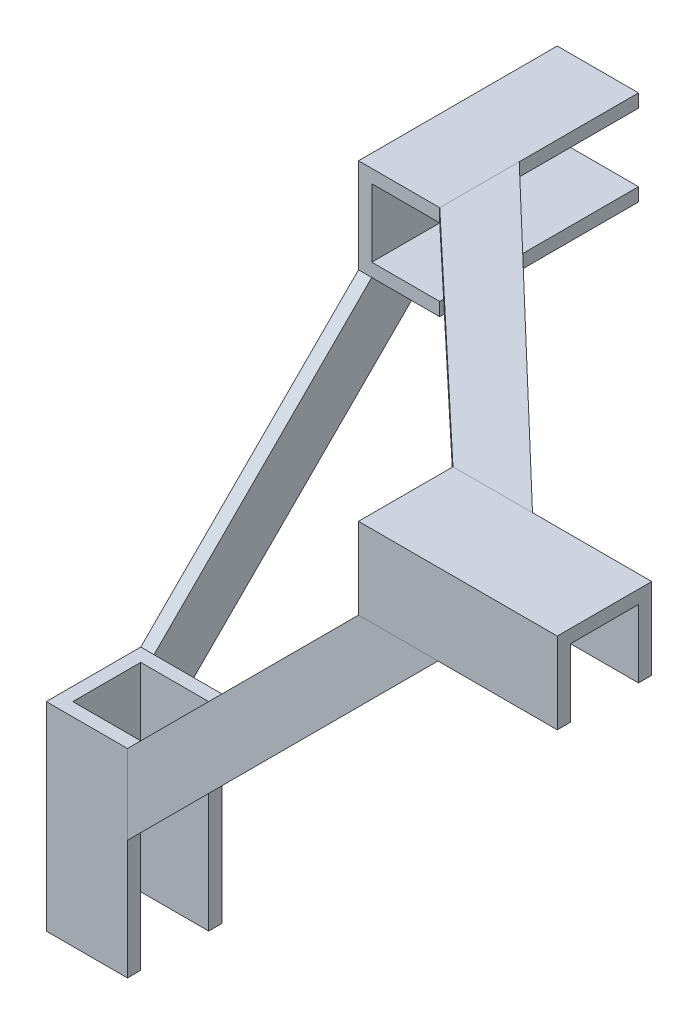
from build123d import *

# Parameters (mm, degrees)
C_START                                 = -12.825
C_CHANNEL_IGVC_5MM_CORNER_3_OUTLINE_W   = 162.175
C_CHANNEL_IGVC_5MM_CORNER_3_OUTLINE_H   = 5
C_CHANNEL_IGVC_5MM_CORNER_3_DEPTH       = 30.65
C_START_2                               = 12.825
C_CHANNEL_IGVC_5MM_CORNER_3_2_DEPTH     = 5
C_START_3                               = -175
C_CHANNEL_IGVC_5MM_CORNER_3_3_DEPTH     = 157.175
C_START_4                               = -17.825
C_CHANNEL_IGVC_5MM_CORNER_3_4_OUTLINE_W = 5
C_CHANNEL_IGVC_5MM_CORNER_3_4_OUTLINE_H = 175
C_CHANNEL_IGVC_5MM_CORNER_3_4_DEPTH     = 30.65
C_CHANNEL_IGVC_5MM_CORNER_3_5_OUTLINE_W = 25.65
C_CHANNEL_IGVC_5MM_CORNER_3_5_OUTLINE_H = 175
C_CHANNEL_IGVC_5MM_CORNER_3_5_DEPTH     = 5
CUT_EXTRUDE1_DEPTH                      = 100
CUT_EXTRUDE1_DEPTH_BACK                 = 100
SKETCH16_W                              = 200
SKETCH16_H                              = 200
BOSS_EXTRUDE2_DEPTH                     = 5
BOSS_EXTRUDE3_DEPTH                     = 5
BOSS_EXTRUDE4_DEPTH                     = 5


# Read off the part's stored shape, not the designer's step: C channel IGVC_5MM_CORNER(3)
with BuildPart() as part:
    # C channel IGVC_5MM_CORNER(3) outline → C channel IGVC_5MM_CORNER(3) (new body)
    with BuildSketch(Plane(origin=(0, 0, 0), x_dir=(1, 0, 0), z_dir=(0, 1, 0)).offset(C_START)):
        with Locations((93.9125, 15.325)):
            Rectangle(C_CHANNEL_IGVC_5MM_CORNER_3_OUTLINE_W, C_CHANNEL_IGVC_5MM_CORNER_3_OUTLINE_H)
        with Locations((93.9125, -15.325)):
            Rectangle(C_CHANNEL_IGVC_5MM_CORNER_3_OUTLINE_W, C_CHANNEL_IGVC_5MM_CORNER_3_OUTLINE_H)
    extrude(amount=C_CHANNEL_IGVC_5MM_CORNER_3_DEPTH)

    # C channel IGVC_5MM_CORNER_3 2 outline → C channel IGVC_5MM_CORNER_3 2 (add)
    with BuildSketch(Plane(origin=(0, 0, 0), x_dir=(1, 0, 0), z_dir=(0, 1, 0)).offset(C_START_2)):
        Polygon((175, -12.825), (175, 12.825), (12.825, 12.825), (12.825, 0), (-12.825, 0), (-12.825, -12.825), align=None)
    extrude(amount=C_CHANNEL_IGVC_5MM_CORNER_3_2_DEPTH)


with BuildPart() as body_2:
    # C channel IGVC_5MM_CORNER_3 3 outline → C channel IGVC_5MM_CORNER_3 3 (new body)
    with BuildSketch(Plane(origin=(0, 0, 0), x_dir=(1, 0, 0), z_dir=(0, 1, 0)).offset(C_START_3)):
        Polygon((12.825, 12.825), (12.825, 17.825), (-17.825, 17.825), (-17.825, -17.825), (12.825, -17.825), (12.825, -12.825), (-12.825, -12.825), (-12.825, 12.825), align=None)
    extrude(amount=C_CHANNEL_IGVC_5MM_CORNER_3_3_DEPTH)


with BuildPart() as body_3:
    # C channel IGVC_5MM_CORNER_3 4 outline → C channel IGVC_5MM_CORNER_3 4 (new body)
    with BuildSketch(Plane.YZ.offset(C_START_4)):
        with Locations((-15.325, -87.5)):
            Rectangle(C_CHANNEL_IGVC_5MM_CORNER_3_4_OUTLINE_W, C_CHANNEL_IGVC_5MM_CORNER_3_4_OUTLINE_H)
        with Locations((15.325, -87.5)):
            Rectangle(C_CHANNEL_IGVC_5MM_CORNER_3_4_OUTLINE_W, C_CHANNEL_IGVC_5MM_CORNER_3_4_OUTLINE_H)
    extrude(amount=C_CHANNEL_IGVC_5MM_CORNER_3_4_DEPTH)

    # C channel IGVC_5MM_CORNER_3 5 outline → C channel IGVC_5MM_CORNER_3 5 (add)
    with BuildSketch(Plane.YZ.offset(C_START_4)):
        with Locations((0, -87.5)):
            Rectangle(C_CHANNEL_IGVC_5MM_CORNER_3_5_OUTLINE_W, C_CHANNEL_IGVC_5MM_CORNER_3_5_OUTLINE_H)
    extrude(amount=C_CHANNEL_IGVC_5MM_CORNER_3_5_DEPTH)


with BuildPart() as cut_extrude1_tool:
    # Sketch16 → Cut-Extrude1 (new, two sides: drawn at the far end of the back side and taken through both)
    with BuildSketch(Plane.XY.offset(-CUT_EXTRUDE1_DEPTH_BACK)):
        Rectangle(SKETCH16_W, SKETCH16_H)
    extrude(amount=CUT_EXTRUDE1_DEPTH + CUT_EXTRUDE1_DEPTH_BACK)


with BuildPart() as part_1:
    add(part.part)

    # Cut-Extrude1: cut by cut_extrude1_tool
    add(cut_extrude1_tool.part, mode=Mode.SUBTRACT)


with BuildPart() as body_2_1:
    add(body_2.part)

    # Cut-Extrude1: cut by cut_extrude1_tool
    add(cut_extrude1_tool.part, mode=Mode.SUBTRACT)


with BuildPart() as body_3_1:
    add(body_3.part)

    # Cut-Extrude1: cut by cut_extrude1_tool
    add(cut_extrude1_tool.part, mode=Mode.SUBTRACT)


with BuildPart() as body_4:
    # Sketch17 → Boss-Extrude2 (new body)
    with BuildSketch(Plane.ZY.offset(17.825)):
        Polygon((-17.825, -100), (-100, -17.825), (-130, -17.825), (-17.825, -130), align=None)
    extrude(amount=-BOSS_EXTRUDE2_DEPTH)


with BuildPart() as body_5:
    # Sketch20 → Boss-Extrude3 (new body)
    with BuildSketch(Plane.XY.offset(17.825)):
        Polygon((12.825, -130), (130, -12.825), (100, -12.825), (12.825, -100), align=None)
    extrude(amount=-BOSS_EXTRUDE3_DEPTH)


with BuildPart() as body_6:
    # Sketch21 → Boss-Extrude4 (new body)
    with BuildSketch(Plane(origin=(0, 17.825, 0), x_dir=(1, 0, 0), z_dir=(0, 1, 0))):
        Polygon((100, 17.825), (12.825, 100), (12.825, 130), (130, 17.825), align=None)
    extrude(amount=-BOSS_EXTRUDE4_DEPTH)


solid = Compound([part_1.part, body_2_1.part, body_3_1.part, body_4.part, body_5.part, body_6.part])
